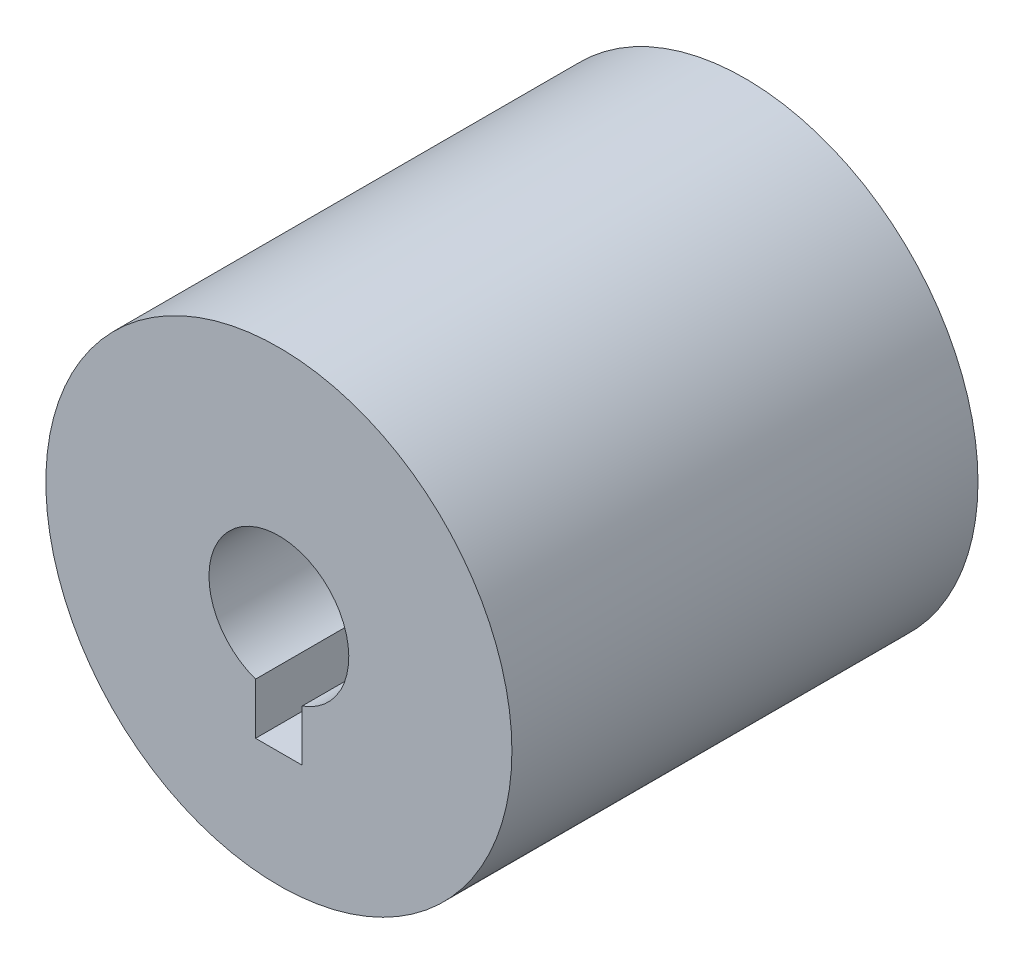
from build123d import *

# Parameters (mm, degrees)
SKETCH1_R           = 5
BOSS_EXTRUDE1_DEPTH = 10
CUT_EXTRUDE1_DEPTH  = 10


with BuildPart() as part:
    # Sketch1 → Boss-Extrude1 (new body)
    with BuildSketch(Plane.XY):
        Circle(SKETCH1_R)
    extrude(amount=BOSS_EXTRUDE1_DEPTH)

    # Sketch2 → Cut-Extrude1 (cut)
    with BuildSketch(Plane(origin=(0, 0, 0), x_dir=(-1, 0, 0), z_dir=(0, 0, -1))):
        with BuildLine():
            Line((-0.5, -1.414213562), (-0.5, -2.514213562))
            Line((-0.5, -2.514213562), (0.5, -2.514213562))
            Line((0.5, -2.514213562), (0.5, -1.414213562))
            ThreePointArc((0.5, -1.414213562), (0, 1.5), (-0.5, -1.414213562))
        make_face()
    extrude(amount=-CUT_EXTRUDE1_DEPTH, mode=Mode.SUBTRACT)


solid = part.part
